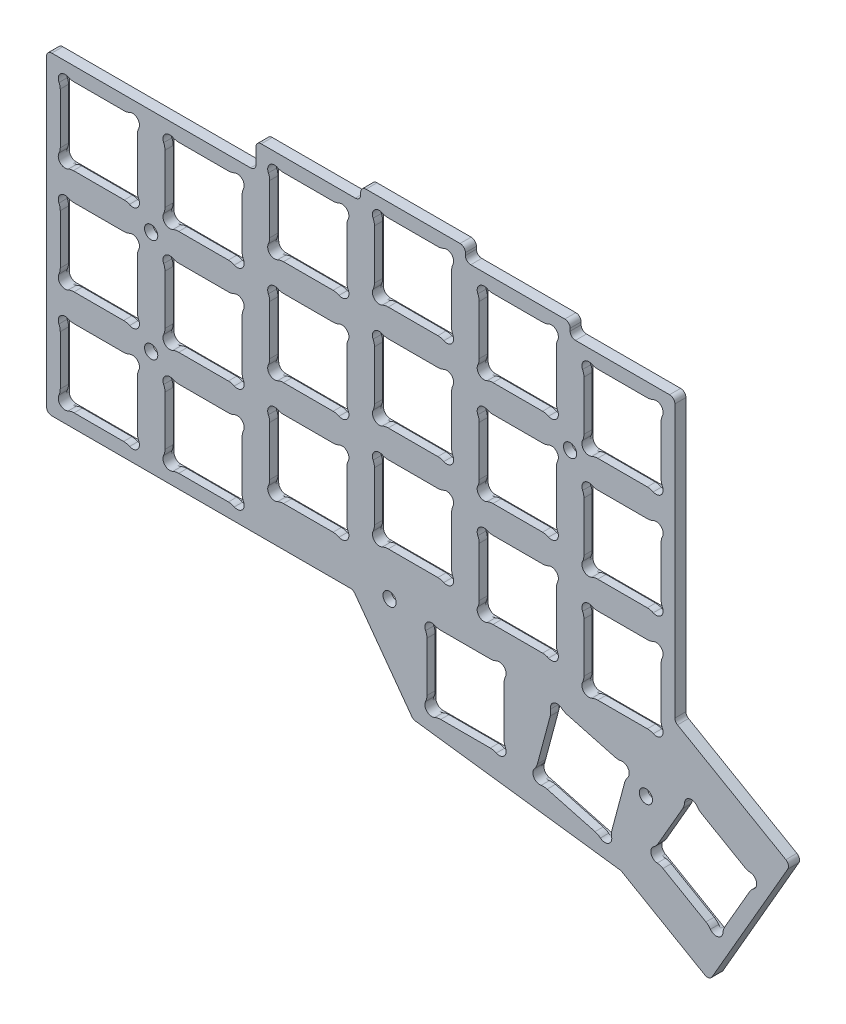
from build123d import *

# Parameters (mm, degrees)
SKETCH2_R           = 1.2
BOSS_EXTRUDE1_DEPTH = 2
FILLET1_R           = 2.5
SKETCH3_R           = 2
CUT_EXTRUDE1_DEPTH  = 0.5


with BuildPart() as part:
    # Sketch2 → Boss-Extrude1 (new body)
    with BuildSketch(Plane.XY):
        with BuildLine():
            ThreePointArc((3.358715952, 91.42556159), (2.678391323, 91.143761902), (2.396591635, 90.463437274))
            Line((2.396591635, 90.463437274), (2.396591635, 35.387693174))
            ThreePointArc((2.396591635, 35.387693174), (2.678391323, 34.707368546), (3.358715952, 34.425568858))
            Line((3.358715952, 34.425568858), (57.55538108, 34.425568858))
            ThreePointArc((57.55538108, 34.425568858), (57.991412266, 34.32109249), (58.332746845, 34.030353412))
            Line((58.332746845, 34.030353412), (68.6731028, 19.851286658))
            ThreePointArc((68.6731028, 19.851286658), (68.959916761, 19.590522811), (69.326358752, 19.464109602))
            Line((69.326358752, 19.464109602), (106.42211034, 14.638604201))
            ThreePointArc((106.42211034, 14.638604201), (106.606561986, 14.595821202), (106.779062685, 14.517742374))
            Line((106.779062685, 14.517742374), (121.831200494, 5.827386558))
            ThreePointArc((121.831200494, 5.827386558), (122.561278749, 5.731269932), (123.145486752, 6.1795485))
            Line((123.145486752, 6.1795485), (136.883362434, 29.974247168))
            ThreePointArc((136.883362434, 29.974247168), (136.979479059, 30.704325424), (136.531200492, 31.288533426))
            Line((136.531200492, 31.288533426), (116.881014221, 42.63357376))
            ThreePointArc((116.881014221, 42.63357376), (116.52885228, 42.985735701), (116.399952063, 43.466797859))
            Line((116.399952063, 43.466797859), (116.399952063, 92.828345033))
            ThreePointArc((116.399952063, 92.828345033), (116.118152375, 93.508669661), (115.437827746, 93.790469349))
            Line((115.437827746, 93.790469349), (98.360317754, 93.790469349))
            ThreePointArc((98.360317754, 93.790469349), (97.679993126, 94.072269037), (97.398193438, 94.752593666))
            Line((97.398193438, 94.752593666), (97.398193438, 95.213192117))
            ThreePointArc((97.398193438, 95.213192117), (97.11639375, 95.893516746), (96.436069121, 96.175316434))
            Line((96.436069121, 96.175316434), (79.359092742, 96.175316434))
            ThreePointArc((79.359092742, 96.175316434), (78.678768113, 96.457116122), (78.396968425, 97.137440751))
            Line((78.396968425, 97.137440751), (78.396968425, 97.587767164))
            ThreePointArc((78.396968425, 97.587767164), (78.115168737, 98.268091793), (77.434844109, 98.54989148))
            Line((77.434844109, 98.54989148), (60.359092745, 98.54989148))
            ThreePointArc((60.359092745, 98.54989148), (59.678768117, 98.268091793), (59.396968429, 97.587767164))
            Line((59.396968429, 97.587767164), (59.396968429, 97.133171852))
            ThreePointArc((59.396968429, 97.133171852), (59.115168741, 96.452847223), (58.434844112, 96.171047535))
            Line((58.434844112, 96.171047535), (41.357156249, 96.171047535))
            ThreePointArc((41.357156249, 96.171047535), (40.676831621, 95.889247847), (40.395031933, 95.208923218))
            Line((40.395031933, 95.208923218), (40.395031933, 92.387685907))
            ThreePointArc((40.395031933, 92.387685907), (40.113232245, 91.707361278), (39.432907616, 91.42556159))
            Line((39.432907616, 91.42556159), (3.358715952, 91.42556159))
        make_face()
        with BuildLine():
            ThreePointArc((17.128824679, 50.925568854), (18.012708155, 51.291685378), (18.896591632, 50.925568854))
            ThreePointArc((18.896591632, 50.925568854), (19.167557571, 50.520039668), (19.262708155, 50.041685378))
            ThreePointArc((19.262708155, 50.041685378), (19.167557571, 49.563331087), (18.896591632, 49.157801901))
            Line((18.896591632, 49.157801901), (18.896591632, 38.693335811))
            ThreePointArc((18.896591632, 38.693335811), (19.167557571, 38.287806624), (19.262708155, 37.809452334))
            ThreePointArc((19.262708155, 37.809452334), (19.167557571, 37.331098044), (18.896591632, 36.925568858))
            ThreePointArc((18.896591632, 36.925568858), (18.012708155, 36.559452334), (17.128824679, 36.925568858))
            Line((17.128824679, 36.925568858), (6.664358588, 36.925568858))
            ThreePointArc((6.664358588, 36.925568858), (5.780475112, 36.559452334), (4.896591635, 36.925568858))
            ThreePointArc((4.896591635, 36.925568858), (4.530475112, 37.809452334), (4.896591635, 38.693335811))
            Line((4.896591635, 38.693335811), (4.896591635, 49.157801901))
            ThreePointArc((4.896591635, 49.157801901), (4.530475112, 50.041685378), (4.896591635, 50.925568854))
            ThreePointArc((4.896591635, 50.925568854), (5.780475112, 51.291685378), (6.664358588, 50.925568854))
            Line((6.664358588, 50.925568854), (17.128824679, 50.925568854))
        make_face(mode=Mode.SUBTRACT)
        with BuildLine():
            ThreePointArc((25.662529929, 36.92624031), (24.778646452, 36.560123786), (23.894762976, 36.92624031))
            ThreePointArc((23.894762976, 36.92624031), (23.528646452, 37.810123786), (23.894762976, 38.694007263))
            Line((23.894762976, 38.694007263), (23.894762976, 49.158473353))
            ThreePointArc((23.894762976, 49.158473353), (23.528646452, 50.04235683), (23.894762976, 50.926240306))
            ThreePointArc((23.894762976, 50.926240306), (24.778646452, 51.29235683), (25.662529929, 50.926240306))
            Line((25.662529929, 50.926240306), (36.126996019, 50.926240306))
            ThreePointArc((36.126996019, 50.926240306), (37.010879496, 51.29235683), (37.894762972, 50.926240306))
            ThreePointArc((37.894762972, 50.926240306), (38.165728911, 50.52071112), (38.260879496, 50.04235683))
            ThreePointArc((38.260879496, 50.04235683), (38.165728911, 49.564002539), (37.894762972, 49.158473353))
            Line((37.894762972, 49.158473353), (37.894762972, 38.694007263))
            ThreePointArc((37.894762972, 38.694007263), (38.165728911, 38.288478077), (38.260879496, 37.810123786))
            ThreePointArc((38.260879496, 37.810123786), (38.165728911, 37.331769496), (37.894762972, 36.92624031))
            ThreePointArc((37.894762972, 36.92624031), (37.010879496, 36.560123786), (36.126996019, 36.92624031))
            Line((36.126996019, 36.92624031), (25.662529929, 36.92624031))
        make_face(mode=Mode.SUBTRACT)
        with Locations((64.637863533, 36.300090173)):
            Circle(SKETCH2_R, mode=Mode.SUBTRACT)
        with BuildLine():
            ThreePointArc((44.662798886, 41.671054802), (43.778915409, 41.304938279), (42.895031933, 41.671054802))
            ThreePointArc((42.895031933, 41.671054802), (42.528915409, 42.554938279), (42.895031933, 43.438821755))
            Line((42.895031933, 43.438821755), (42.895031933, 53.903287846))
            ThreePointArc((42.895031933, 53.903287846), (42.528915409, 54.787171322), (42.895031933, 55.671054799))
            ThreePointArc((42.895031933, 55.671054799), (43.778915409, 56.037171322), (44.662798886, 55.671054799))
            Line((44.662798886, 55.671054799), (55.127264976, 55.671054799))
            ThreePointArc((55.127264976, 55.671054799), (56.011148453, 56.037171322), (56.895031929, 55.671054799))
            ThreePointArc((56.895031929, 55.671054799), (57.165997868, 55.265525613), (57.261148453, 54.787171322))
            ThreePointArc((57.261148453, 54.787171322), (57.165997868, 54.308817032), (56.895031929, 53.903287846))
            Line((56.895031929, 53.903287846), (56.895031929, 43.438821755))
            ThreePointArc((56.895031929, 43.438821755), (57.165997868, 43.033292569), (57.261148453, 42.554938279))
            ThreePointArc((57.261148453, 42.554938279), (57.165997868, 42.076583988), (56.895031929, 41.671054802))
            ThreePointArc((56.895031929, 41.671054802), (56.011148453, 41.304938279), (55.127264976, 41.671054802))
            Line((55.127264976, 41.671054802), (44.662798886, 41.671054802))
        make_face(mode=Mode.SUBTRACT)
        with BuildLine():
            ThreePointArc((63.664735382, 44.049898748), (62.780851905, 43.683782224), (61.896968429, 44.049898748))
            ThreePointArc((61.896968429, 44.049898748), (61.530851905, 44.933782224), (61.896968429, 45.817665701))
            Line((61.896968429, 45.817665701), (61.896968429, 56.282131791))
            ThreePointArc((61.896968429, 56.282131791), (61.530851905, 57.166015268), (61.896968429, 58.049898744))
            ThreePointArc((61.896968429, 58.049898744), (62.780851905, 58.416015268), (63.664735382, 58.049898744))
            Line((63.664735382, 58.049898744), (74.129201472, 58.049898744))
            ThreePointArc((74.129201472, 58.049898744), (75.013084949, 58.416015268), (75.896968425, 58.049898744))
            ThreePointArc((75.896968425, 58.049898744), (76.167934364, 57.644369558), (76.263084949, 57.166015268))
            ThreePointArc((76.263084949, 57.166015268), (76.167934364, 56.687660977), (75.896968425, 56.282131791))
            Line((75.896968425, 56.282131791), (75.896968425, 45.817665701))
            ThreePointArc((75.896968425, 45.817665701), (76.167934364, 45.412136515), (76.263084949, 44.933782224))
            ThreePointArc((76.263084949, 44.933782224), (76.167934364, 44.455427934), (75.896968425, 44.049898748))
            ThreePointArc((75.896968425, 44.049898748), (75.013084949, 43.683782224), (74.129201472, 44.049898748))
            Line((74.129201472, 44.049898748), (63.664735382, 44.049898748))
        make_face(mode=Mode.SUBTRACT)
        with BuildLine():
            ThreePointArc((106.244867582, 31.71451574), (107.193391389, 31.839391268), (107.952399337, 31.256983985))
            ThreePointArc((107.952399337, 31.256983985), (108.077274865, 30.955507792), (108.119867582, 30.631983985))
            ThreePointArc((108.119867582, 30.631983985), (107.952399337, 30.006983985), (107.494867582, 29.549452231))
            Line((107.494867582, 29.549452231), (104.786464461, 19.441554176))
            ThreePointArc((104.786464461, 19.441554176), (104.911339989, 19.140077982), (104.953932707, 18.816554176))
            ThreePointArc((104.953932707, 18.816554176), (104.786464461, 18.191554176), (104.328932707, 17.734022421))
            ThreePointArc((104.328932707, 17.734022421), (103.3804089, 17.609146893), (102.621400952, 18.191554176))
            Line((102.621400952, 18.191554176), (92.513502897, 20.899957297))
            ThreePointArc((92.513502897, 20.899957297), (91.56497909, 20.775081768), (90.805971142, 21.357489051))
            ThreePointArc((90.805971142, 21.357489051), (90.681095614, 22.306012858), (91.263502897, 23.065020806))
            Line((91.263502897, 23.065020806), (93.971906018, 33.172918861))
            ThreePointArc((93.971906018, 33.172918861), (93.84703049, 34.121442668), (94.429437772, 34.880450616))
            ThreePointArc((94.429437772, 34.880450616), (95.377961579, 35.005326144), (96.136969527, 34.422918861))
            Line((96.136969527, 34.422918861), (106.244867582, 31.71451574))
        make_face(mode=Mode.SUBTRACT)
        with Locations((111.137845658, 28.550051811)):
            Circle(SKETCH2_R, mode=Mode.SUBTRACT)
        with BuildLine():
            ThreePointArc((113.605936524, 19.12102891), (112.657412717, 19.245904438), (112.075005434, 20.004912386))
            ThreePointArc((112.075005434, 20.004912386), (112.199880962, 20.953436193), (112.958888911, 21.535843475))
            Line((112.958888911, 21.535843475), (118.191121956, 30.598336947))
            ThreePointArc((118.191121956, 30.598336947), (118.315997484, 31.546860753), (119.075005433, 32.129268036))
            ThreePointArc((119.075005433, 32.129268036), (120.023529239, 32.004392508), (120.605936522, 31.24538456))
            Line((120.605936522, 31.24538456), (129.668429993, 26.013151514))
            ThreePointArc((129.668429993, 26.013151514), (130.6169538, 25.888275986), (131.199361083, 25.129268038))
            ThreePointArc((131.199361083, 25.129268038), (131.231259876, 24.968901972), (131.2419538, 24.805744231))
            ThreePointArc((131.2419538, 24.805744231), (130.983645475, 24.044792445), (130.315477606, 23.598336949))
            Line((130.315477606, 23.598336949), (125.083244561, 14.535843477))
            ThreePointArc((125.083244561, 14.535843477), (125.115143355, 14.375477411), (125.125837278, 14.212319671))
            ThreePointArc((125.125837278, 14.212319671), (124.867528953, 13.451367885), (124.199361084, 13.004912388))
            ThreePointArc((124.199361084, 13.004912388), (123.250837278, 13.129787916), (122.668429995, 13.888795864))
            Line((122.668429995, 13.888795864), (113.605936524, 19.12102891))
        make_face(mode=Mode.SUBTRACT)
        with BuildLine():
            ThreePointArc((83.648818986, 36.01741384), (84.532702463, 36.383530364), (85.416585939, 36.01741384))
            ThreePointArc((85.416585939, 36.01741384), (85.687551879, 35.611884654), (85.782702463, 35.133530364))
            ThreePointArc((85.782702463, 35.133530364), (85.687551879, 34.655176073), (85.416585939, 34.249646887))
            Line((85.416585939, 34.249646887), (85.416585939, 23.785180797))
            ThreePointArc((85.416585939, 23.785180797), (85.687551879, 23.379651611), (85.782702463, 22.90129732))
            ThreePointArc((85.782702463, 22.90129732), (85.687551879, 22.42294303), (85.416585939, 22.017413844))
            ThreePointArc((85.416585939, 22.017413844), (84.532702463, 21.65129732), (83.648818986, 22.017413844))
            Line((83.648818986, 22.017413844), (73.184352896, 22.017413844))
            ThreePointArc((73.184352896, 22.017413844), (72.300469419, 21.65129732), (71.416585943, 22.017413844))
            ThreePointArc((71.416585943, 22.017413844), (71.050469419, 22.90129732), (71.416585943, 23.785180797))
            Line((71.416585943, 23.785180797), (71.416585943, 34.249646887))
            ThreePointArc((71.416585943, 34.249646887), (71.050469419, 35.133530364), (71.416585943, 36.01741384))
            ThreePointArc((71.416585943, 36.01741384), (72.300469419, 36.383530364), (73.184352896, 36.01741384))
            Line((73.184352896, 36.01741384), (83.648818986, 36.01741384))
        make_face(mode=Mode.SUBTRACT)
        with BuildLine():
            ThreePointArc((82.665960394, 41.675323701), (81.782076918, 41.309207178), (80.898193441, 41.675323701))
            ThreePointArc((80.898193441, 41.675323701), (80.532076918, 42.559207178), (80.898193441, 43.443090654))
            Line((80.898193441, 43.443090654), (80.898193441, 53.907556745))
            ThreePointArc((80.898193441, 53.907556745), (80.532076918, 54.791440221), (80.898193441, 55.675323698))
            ThreePointArc((80.898193441, 55.675323698), (81.782076918, 56.041440221), (82.665960394, 55.675323698))
            Line((82.665960394, 55.675323698), (93.130426485, 55.675323698))
            ThreePointArc((93.130426485, 55.675323698), (94.014309961, 56.041440221), (94.898193438, 55.675323698))
            ThreePointArc((94.898193438, 55.675323698), (95.169159377, 55.269794512), (95.264309961, 54.791440221))
            ThreePointArc((95.264309961, 54.791440221), (95.169159377, 54.313085931), (94.898193438, 53.907556745))
            Line((94.898193438, 53.907556745), (94.898193438, 43.443090654))
            ThreePointArc((94.898193438, 43.443090654), (95.169159377, 43.037561468), (95.264309961, 42.559207178))
            ThreePointArc((95.264309961, 42.559207178), (95.169159377, 42.080852887), (94.898193438, 41.675323701))
            ThreePointArc((94.898193438, 41.675323701), (94.014309961, 41.309207178), (93.130426485, 41.675323701))
            Line((93.130426485, 41.675323701), (82.665960394, 41.675323701))
        make_face(mode=Mode.SUBTRACT)
        with BuildLine():
            ThreePointArc((101.667719019, 39.290476616), (100.783835543, 38.924360093), (99.899952066, 39.290476616))
            ThreePointArc((99.899952066, 39.290476616), (99.533835543, 40.174360093), (99.899952066, 41.058243569))
            Line((99.899952066, 41.058243569), (99.899952066, 51.52270966))
            ThreePointArc((99.899952066, 51.52270966), (99.533835543, 52.406593136), (99.899952066, 53.290476613))
            ThreePointArc((99.899952066, 53.290476613), (100.783835543, 53.656593136), (101.667719019, 53.290476613))
            Line((101.667719019, 53.290476613), (112.13218511, 53.290476613))
            ThreePointArc((112.13218511, 53.290476613), (113.016068586, 53.656593136), (113.899952063, 53.290476613))
            ThreePointArc((113.899952063, 53.290476613), (114.170918002, 52.884947427), (114.266068586, 52.406593136))
            ThreePointArc((114.266068586, 52.406593136), (114.170918002, 51.928238846), (113.899952063, 51.52270966))
            Line((113.899952063, 51.52270966), (113.899952063, 41.058243569))
            ThreePointArc((113.899952063, 41.058243569), (114.170918002, 40.652714383), (114.266068586, 40.174360093))
            ThreePointArc((114.266068586, 40.174360093), (114.170918002, 39.696005802), (113.899952063, 39.290476616))
            ThreePointArc((113.899952063, 39.290476616), (113.016068586, 38.924360093), (112.13218511, 39.290476616))
            Line((112.13218511, 39.290476616), (101.667719019, 39.290476616))
        make_face(mode=Mode.SUBTRACT)
        with BuildLine():
            ThreePointArc((6.664358588, 55.925568853), (5.780475112, 55.559452329), (4.896591635, 55.925568853))
            ThreePointArc((4.896591635, 55.925568853), (4.530475112, 56.809452329), (4.896591635, 57.693335806))
            Line((4.896591635, 57.693335806), (4.896591635, 68.157801896))
            ThreePointArc((4.896591635, 68.157801896), (4.530475112, 69.041685373), (4.896591635, 69.925568849))
            ThreePointArc((4.896591635, 69.925568849), (5.780475112, 70.291685373), (6.664358588, 69.925568849))
            Line((6.664358588, 69.925568849), (17.128824679, 69.925568849))
            ThreePointArc((17.128824679, 69.925568849), (18.012708155, 70.291685373), (18.896591632, 69.925568849))
            ThreePointArc((18.896591632, 69.925568849), (19.167557571, 69.520039663), (19.262708155, 69.041685373))
            ThreePointArc((19.262708155, 69.041685373), (19.167557571, 68.563331082), (18.896591632, 68.157801896))
            Line((18.896591632, 68.157801896), (18.896591632, 57.693335806))
            ThreePointArc((18.896591632, 57.693335806), (19.167557571, 57.28780662), (19.262708155, 56.809452329))
            ThreePointArc((19.262708155, 56.809452329), (19.167557571, 56.331098039), (18.896591632, 55.925568853))
            ThreePointArc((18.896591632, 55.925568853), (18.012708155, 55.559452329), (17.128824679, 55.925568853))
            Line((17.128824679, 55.925568853), (6.664358588, 55.925568853))
        make_face(mode=Mode.SUBTRACT)
        with Locations((21.387798276, 53.550235091)):
            Circle(SKETCH2_R, mode=Mode.SUBTRACT)
        with BuildLine():
            ThreePointArc((25.662529929, 55.926240305), (24.778646452, 55.560123781), (23.894762976, 55.926240305))
            ThreePointArc((23.894762976, 55.926240305), (23.528646452, 56.810123781), (23.894762976, 57.694007258))
            Line((23.894762976, 57.694007258), (23.894762976, 68.158473348))
            ThreePointArc((23.894762976, 68.158473348), (23.528646452, 69.042356825), (23.894762976, 69.926240301))
            ThreePointArc((23.894762976, 69.926240301), (24.778646452, 70.292356825), (25.662529929, 69.926240301))
            Line((25.662529929, 69.926240301), (36.126996019, 69.926240301))
            ThreePointArc((36.126996019, 69.926240301), (37.010879496, 70.292356825), (37.894762972, 69.926240301))
            ThreePointArc((37.894762972, 69.926240301), (38.165728911, 69.520711115), (38.260879496, 69.042356825))
            ThreePointArc((38.260879496, 69.042356825), (38.165728911, 68.564002534), (37.894762972, 68.158473348))
            Line((37.894762972, 68.158473348), (37.894762972, 57.694007258))
            ThreePointArc((37.894762972, 57.694007258), (38.165728911, 57.288478072), (38.260879496, 56.810123781))
            ThreePointArc((38.260879496, 56.810123781), (38.165728911, 56.331769491), (37.894762972, 55.926240305))
            ThreePointArc((37.894762972, 55.926240305), (37.010879496, 55.560123781), (36.126996019, 55.926240305))
            Line((36.126996019, 55.926240305), (25.662529929, 55.926240305))
        make_face(mode=Mode.SUBTRACT)
        with Locations((21.387798276, 72.300241098)):
            Circle(SKETCH2_R, mode=Mode.SUBTRACT)
        with BuildLine():
            ThreePointArc((44.662798886, 60.671054797), (43.778915409, 60.304938274), (42.895031933, 60.671054797))
            ThreePointArc((42.895031933, 60.671054797), (42.528915409, 61.554938274), (42.895031933, 62.43882175))
            Line((42.895031933, 62.43882175), (42.895031933, 72.903287841))
            ThreePointArc((42.895031933, 72.903287841), (42.528915409, 73.787171317), (42.895031933, 74.671054794))
            ThreePointArc((42.895031933, 74.671054794), (43.778915409, 75.037171317), (44.662798886, 74.671054794))
            Line((44.662798886, 74.671054794), (55.127264976, 74.671054794))
            ThreePointArc((55.127264976, 74.671054794), (56.011148453, 75.037171317), (56.895031929, 74.671054794))
            ThreePointArc((56.895031929, 74.671054794), (57.165997868, 74.265525608), (57.261148453, 73.787171317))
            ThreePointArc((57.261148453, 73.787171317), (57.165997868, 73.308817027), (56.895031929, 72.903287841))
            Line((56.895031929, 72.903287841), (56.895031929, 62.43882175))
            ThreePointArc((56.895031929, 62.43882175), (57.165997868, 62.033292564), (57.261148453, 61.554938274))
            ThreePointArc((57.261148453, 61.554938274), (57.165997868, 61.076583983), (56.895031929, 60.671054797))
            ThreePointArc((56.895031929, 60.671054797), (56.011148453, 60.304938274), (55.127264976, 60.671054797))
            Line((55.127264976, 60.671054797), (44.662798886, 60.671054797))
        make_face(mode=Mode.SUBTRACT)
        with BuildLine():
            ThreePointArc((63.664735382, 63.049898743), (62.780851905, 62.683782219), (61.896968429, 63.049898743))
            ThreePointArc((61.896968429, 63.049898743), (61.530851905, 63.933782219), (61.896968429, 64.817665696))
            Line((61.896968429, 64.817665696), (61.896968429, 75.282131786))
            ThreePointArc((61.896968429, 75.282131786), (61.530851905, 76.166015263), (61.896968429, 77.049898739))
            ThreePointArc((61.896968429, 77.049898739), (62.780851905, 77.416015263), (63.664735382, 77.049898739))
            Line((63.664735382, 77.049898739), (74.129201472, 77.049898739))
            ThreePointArc((74.129201472, 77.049898739), (75.013084949, 77.416015263), (75.896968425, 77.049898739))
            ThreePointArc((75.896968425, 77.049898739), (76.167934364, 76.644369553), (76.263084949, 76.166015263))
            ThreePointArc((76.263084949, 76.166015263), (76.167934364, 75.687660972), (75.896968425, 75.282131786))
            Line((75.896968425, 75.282131786), (75.896968425, 64.817665696))
            ThreePointArc((75.896968425, 64.817665696), (76.167934364, 64.41213651), (76.263084949, 63.933782219))
            ThreePointArc((76.263084949, 63.933782219), (76.167934364, 63.455427929), (75.896968425, 63.049898743))
            ThreePointArc((75.896968425, 63.049898743), (75.013084949, 62.683782219), (74.129201472, 63.049898743))
            Line((74.129201472, 63.049898743), (63.664735382, 63.049898743))
        make_face(mode=Mode.SUBTRACT)
        with BuildLine():
            ThreePointArc((17.436334559, 74.700259118), (16.988797184, 74.868419675), (16.514136804, 74.925561594))
            Line((16.514136804, 74.925561594), (7.279046463, 74.925561594))
            ThreePointArc((7.279046463, 74.925561594), (6.804386083, 74.868419675), (6.356848708, 74.700259118))
            ThreePointArc((6.356848708, 74.700259118), (4.896591635, 74.925561594), (4.671289159, 76.385818667))
            ThreePointArc((4.671289159, 76.385818667), (4.839449716, 76.833356042), (4.896591635, 77.308016421))
            Line((4.896591635, 77.308016421), (4.896591635, 86.543106763))
            ThreePointArc((4.896591635, 86.543106763), (4.839449716, 87.017767143), (4.671289159, 87.465304517))
            ThreePointArc((4.671289159, 87.465304517), (4.896591635, 88.92556159), (6.356848708, 89.150864066))
            ThreePointArc((6.356848708, 89.150864066), (6.804386083, 88.982703509), (7.279046463, 88.92556159))
            Line((7.279046463, 88.92556159), (16.514136804, 88.92556159))
            ThreePointArc((16.514136804, 88.92556159), (16.988797184, 88.982703509), (17.436334559, 89.150864066))
            ThreePointArc((17.436334559, 89.150864066), (18.896591632, 88.92556159), (19.121894108, 87.465304517))
            ThreePointArc((19.121894108, 87.465304517), (18.95373355, 87.017767143), (18.896591632, 86.543106763))
            Line((18.896591632, 86.543106763), (18.896591632, 77.308016421))
            ThreePointArc((18.896591632, 77.308016421), (18.95373355, 76.833356042), (19.121894108, 76.385818667))
            ThreePointArc((19.121894108, 76.385818667), (18.896591632, 74.925561594), (17.436334559, 74.700259118))
        make_face(mode=Mode.SUBTRACT)
        with BuildLine():
            ThreePointArc((23.894762976, 87.15846609), (23.528646452, 88.042349566), (23.894762976, 88.926233042))
            ThreePointArc((23.894762976, 88.926233042), (24.778646452, 89.292349566), (25.662529929, 88.926233042))
            Line((25.662529929, 88.926233042), (36.126996019, 88.926233042))
            ThreePointArc((36.126996019, 88.926233042), (37.010879496, 89.292349566), (37.894762972, 88.926233042))
            ThreePointArc((37.894762972, 88.926233042), (38.165728911, 88.520703856), (38.260879496, 88.042349566))
            ThreePointArc((38.260879496, 88.042349566), (38.165728911, 87.563995276), (37.894762972, 87.15846609))
            Line((37.894762972, 87.15846609), (37.894762972, 76.693999999))
            ThreePointArc((37.894762972, 76.693999999), (38.165728911, 76.288470813), (38.260879496, 75.810116522))
            ThreePointArc((38.260879496, 75.810116522), (38.165728911, 75.331762232), (37.894762972, 74.926233046))
            ThreePointArc((37.894762972, 74.926233046), (37.010879496, 74.560116522), (36.126996019, 74.926233046))
            Line((36.126996019, 74.926233046), (25.662529929, 74.926233046))
            ThreePointArc((25.662529929, 74.926233046), (24.778646452, 74.560116522), (23.894762976, 74.926233046))
            ThreePointArc((23.894762976, 74.926233046), (23.528646452, 75.810116522), (23.894762976, 76.693999999))
            Line((23.894762976, 76.693999999), (23.894762976, 87.15846609))
        make_face(mode=Mode.SUBTRACT)
        with BuildLine():
            ThreePointArc((44.662798886, 79.671047539), (43.778915409, 79.304931015), (42.895031933, 79.671047539))
            ThreePointArc((42.895031933, 79.671047539), (42.528915409, 80.554931015), (42.895031933, 81.438814491))
            Line((42.895031933, 81.438814491), (42.895031933, 91.903280582))
            ThreePointArc((42.895031933, 91.903280582), (42.528915409, 92.787164059), (42.895031933, 93.671047535))
            ThreePointArc((42.895031933, 93.671047535), (43.778915409, 94.037164059), (44.662798886, 93.671047535))
            Line((44.662798886, 93.671047535), (55.127264976, 93.671047535))
            ThreePointArc((55.127264976, 93.671047535), (56.011148453, 94.037164059), (56.895031929, 93.671047535))
            ThreePointArc((56.895031929, 93.671047535), (57.165997868, 93.265518349), (57.261148453, 92.787164059))
            ThreePointArc((57.261148453, 92.787164059), (57.165997868, 92.308809768), (56.895031929, 91.903280582))
            Line((56.895031929, 91.903280582), (56.895031929, 81.438814491))
            ThreePointArc((56.895031929, 81.438814491), (57.165997868, 81.033285305), (57.261148453, 80.554931015))
            ThreePointArc((57.261148453, 80.554931015), (57.165997868, 80.076576725), (56.895031929, 79.671047539))
            ThreePointArc((56.895031929, 79.671047539), (56.011148453, 79.304931015), (55.127264976, 79.671047539))
            Line((55.127264976, 79.671047539), (44.662798886, 79.671047539))
        make_face(mode=Mode.SUBTRACT)
        with BuildLine():
            ThreePointArc((63.664735382, 82.049891484), (62.780851905, 81.68377496), (61.896968429, 82.049891484))
            ThreePointArc((61.896968429, 82.049891484), (61.530851905, 82.93377496), (61.896968429, 83.817658437))
            Line((61.896968429, 83.817658437), (61.896968429, 94.282124528))
            ThreePointArc((61.896968429, 94.282124528), (61.530851905, 95.166008004), (61.896968429, 96.04989148))
            ThreePointArc((61.896968429, 96.04989148), (62.780851905, 96.416008004), (63.664735382, 96.04989148))
            Line((63.664735382, 96.04989148), (74.129201472, 96.04989148))
            ThreePointArc((74.129201472, 96.04989148), (75.013084949, 96.416008004), (75.896968425, 96.04989148))
            ThreePointArc((75.896968425, 96.04989148), (76.167934364, 95.644362294), (76.263084949, 95.166008004))
            ThreePointArc((76.263084949, 95.166008004), (76.167934364, 94.687653714), (75.896968425, 94.282124528))
            Line((75.896968425, 94.282124528), (75.896968425, 83.817658437))
            ThreePointArc((75.896968425, 83.817658437), (76.167934364, 83.412129251), (76.263084949, 82.93377496))
            ThreePointArc((76.263084949, 82.93377496), (76.167934364, 82.45542067), (75.896968425, 82.049891484))
            ThreePointArc((75.896968425, 82.049891484), (75.013084949, 81.68377496), (74.129201472, 82.049891484))
            Line((74.129201472, 82.049891484), (63.664735382, 82.049891484))
        make_face(mode=Mode.SUBTRACT)
        with BuildLine():
            ThreePointArc((93.130426485, 74.675323693), (94.014309961, 75.041440216), (94.898193438, 74.675323693))
            ThreePointArc((94.898193438, 74.675323693), (95.169159377, 74.269794507), (95.264309961, 73.791440216))
            ThreePointArc((95.264309961, 73.791440216), (95.169159377, 73.313085926), (94.898193438, 72.90755674))
            Line((94.898193438, 72.90755674), (94.898193438, 62.443090649))
            ThreePointArc((94.898193438, 62.443090649), (95.169159377, 62.037561463), (95.264309961, 61.559207173))
            ThreePointArc((95.264309961, 61.559207173), (95.169159377, 61.080852882), (94.898193438, 60.675323696))
            ThreePointArc((94.898193438, 60.675323696), (94.014309961, 60.309207173), (93.130426485, 60.675323696))
            Line((93.130426485, 60.675323696), (82.665960394, 60.675323696))
            ThreePointArc((82.665960394, 60.675323696), (81.782076918, 60.309207173), (80.898193441, 60.675323696))
            ThreePointArc((80.898193441, 60.675323696), (80.532076918, 61.559207173), (80.898193441, 62.443090649))
            Line((80.898193441, 62.443090649), (80.898193441, 72.90755674))
            ThreePointArc((80.898193441, 72.90755674), (80.532076918, 73.791440216), (80.898193441, 74.675323693))
            ThreePointArc((80.898193441, 74.675323693), (81.782076918, 75.041440216), (82.665960394, 74.675323693))
            Line((82.665960394, 74.675323693), (93.130426485, 74.675323693))
        make_face(mode=Mode.SUBTRACT)
        with BuildLine():
            ThreePointArc((101.667719019, 58.290476612), (100.783835543, 57.924360088), (99.899952066, 58.290476612))
            ThreePointArc((99.899952066, 58.290476612), (99.533835543, 59.174360088), (99.899952066, 60.058243565))
            Line((99.899952066, 60.058243565), (99.899952066, 70.522709655))
            ThreePointArc((99.899952066, 70.522709655), (99.533835543, 71.406593132), (99.899952066, 72.290476608))
            ThreePointArc((99.899952066, 72.290476608), (100.783835543, 72.656593132), (101.667719019, 72.290476608))
            Line((101.667719019, 72.290476608), (112.13218511, 72.290476608))
            ThreePointArc((112.13218511, 72.290476608), (113.016068586, 72.656593132), (113.899952063, 72.290476608))
            ThreePointArc((113.899952063, 72.290476608), (114.170918002, 71.884947422), (114.266068586, 71.406593132))
            ThreePointArc((114.266068586, 71.406593132), (114.170918002, 70.928238841), (113.899952063, 70.522709655))
            Line((113.899952063, 70.522709655), (113.899952063, 60.058243565))
            ThreePointArc((113.899952063, 60.058243565), (114.170918002, 59.652714379), (114.266068586, 59.174360088))
            ThreePointArc((114.266068586, 59.174360088), (114.170918002, 58.696005798), (113.899952063, 58.290476612))
            ThreePointArc((113.899952063, 58.290476612), (113.016068586, 57.924360088), (112.13218511, 58.290476612))
            Line((112.13218511, 58.290476612), (101.667719019, 58.290476612))
        make_face(mode=Mode.SUBTRACT)
        with Locations((97.387827206, 76.050038887)):
            Circle(SKETCH2_R, mode=Mode.SUBTRACT)
        with BuildLine():
            ThreePointArc((82.665960394, 79.675316437), (81.782076918, 79.309199914), (80.898193441, 79.675316437))
            ThreePointArc((80.898193441, 79.675316437), (80.532076918, 80.559199914), (80.898193441, 81.44308339))
            Line((80.898193441, 81.44308339), (80.898193441, 91.907549481))
            ThreePointArc((80.898193441, 91.907549481), (80.532076918, 92.791432957), (80.898193441, 93.675316434))
            ThreePointArc((80.898193441, 93.675316434), (81.782076918, 94.041432957), (82.665960394, 93.675316434))
            Line((82.665960394, 93.675316434), (93.130426485, 93.675316434))
            ThreePointArc((93.130426485, 93.675316434), (94.014309961, 94.041432957), (94.898193438, 93.675316434))
            ThreePointArc((94.898193438, 93.675316434), (95.169159377, 93.269787248), (95.264309961, 92.791432957))
            ThreePointArc((95.264309961, 92.791432957), (95.169159377, 92.313078667), (94.898193438, 91.907549481))
            Line((94.898193438, 91.907549481), (94.898193438, 81.44308339))
            ThreePointArc((94.898193438, 81.44308339), (95.169159377, 81.037554204), (95.264309961, 80.559199914))
            ThreePointArc((95.264309961, 80.559199914), (95.169159377, 80.080845624), (94.898193438, 79.675316437))
            ThreePointArc((94.898193438, 79.675316437), (94.014309961, 79.309199914), (93.130426485, 79.675316437))
            Line((93.130426485, 79.675316437), (82.665960394, 79.675316437))
        make_face(mode=Mode.SUBTRACT)
        with BuildLine():
            ThreePointArc((101.667719019, 77.290469353), (100.783835543, 76.924352829), (99.899952066, 77.290469353))
            ThreePointArc((99.899952066, 77.290469353), (99.533835543, 78.174352829), (99.899952066, 79.058236306))
            Line((99.899952066, 79.058236306), (99.899952066, 89.522702396))
            ThreePointArc((99.899952066, 89.522702396), (99.533835543, 90.406585873), (99.899952066, 91.290469349))
            ThreePointArc((99.899952066, 91.290469349), (100.783835543, 91.656585873), (101.667719019, 91.290469349))
            Line((101.667719019, 91.290469349), (112.13218511, 91.290469349))
            ThreePointArc((112.13218511, 91.290469349), (113.016068586, 91.656585873), (113.899952063, 91.290469349))
            ThreePointArc((113.899952063, 91.290469349), (114.170918002, 90.884940163), (114.266068586, 90.406585873))
            ThreePointArc((114.266068586, 90.406585873), (114.170918002, 89.928231582), (113.899952063, 89.522702396))
            Line((113.899952063, 89.522702396), (113.899952063, 79.058236306))
            ThreePointArc((113.899952063, 79.058236306), (114.170918002, 78.65270712), (114.266068586, 78.174352829))
            ThreePointArc((114.266068586, 78.174352829), (114.170918002, 77.695998539), (113.899952063, 77.290469353))
            ThreePointArc((113.899952063, 77.290469353), (113.016068586, 76.924352829), (112.13218511, 77.290469353))
            Line((112.13218511, 77.290469353), (101.667719019, 77.290469353))
        make_face(mode=Mode.SUBTRACT)
    extrude(amount=BOSS_EXTRUDE1_DEPTH)

    # Fillet1
    fillet1_edges = [part.edges().sort_by_distance(p)[0] for p in [
        (44.662798886, 79.671047539, 1),
        (42.895031933, 81.438814491, 1),
        (55.127264976, 79.671047539, 1),
        (56.895031929, 81.438814491, 1),
        (56.895031929, 91.903280582, 1),
        (55.127264976, 93.671047535, 1),
        (42.895031933, 91.903280582, 1),
        (44.662798886, 93.671047535, 1),
        (37.894762972, 76.693999999, 1),
        (37.894762972, 87.15846609, 1),
        (36.126996019, 88.926233042, 1),
        (25.662529929, 88.926233042, 1),
        (36.126996019, 74.926233046, 1),
        (25.662529929, 74.926233046, 1),
        (23.894762976, 76.693999999, 1),
        (23.894762976, 87.15846609, 1),
        (74.129201472, 96.04989148, 1),
        (75.896968425, 94.282124528, 1),
        (75.896968425, 83.817658437, 1),
        (74.129201472, 82.049891484, 1),
        (63.664735382, 96.04989148, 1),
        (63.664735382, 82.049891484, 1),
        (61.896968429, 83.817658437, 1),
        (61.896968429, 94.282124528, 1),
        (55.127264976, 55.671054799, 1),
        (56.895031929, 53.903287846, 1),
        (44.662798886, 55.671054799, 1),
        (42.895031933, 53.903287846, 1),
        (42.895031933, 43.438821755, 1),
        (44.662798886, 41.671054802, 1),
        (56.895031929, 43.438821755, 1),
        (55.127264976, 41.671054802, 1),
        (25.662529929, 50.926240306, 1),
        (23.894762976, 49.158473353, 1),
        (36.126996019, 50.926240306, 1),
        (37.894762972, 49.158473353, 1),
        (37.894762972, 38.694007263, 1),
        (36.126996019, 36.92624031, 1),
        (23.894762976, 38.694007263, 1),
        (25.662529929, 36.92624031, 1),
        (17.128824679, 50.925568854, 1),
        (18.896591632, 49.157801901, 1),
        (6.664358588, 50.925568854, 1),
        (4.896591635, 49.157801901, 1),
        (4.896591635, 38.693335811, 1),
        (6.664358588, 36.925568858, 1),
        (17.128824679, 36.925568858, 1),
        (18.896591632, 38.693335811, 1),
        (6.664358588, 69.925568849, 1),
        (4.896591635, 68.157801896, 1),
        (4.896591635, 57.693335806, 1),
        (6.664358588, 55.925568853, 1),
        (17.128824679, 55.925568853, 1),
        (18.896591632, 57.693335806, 1),
        (17.128824679, 69.925568849, 1),
        (18.896591632, 68.157801896, 1),
        (23.894762976, 68.158473348, 1),
        (25.662529929, 69.926240301, 1),
        (23.894762976, 57.694007258, 1),
        (25.662529929, 55.926240305, 1),
        (36.126996019, 55.926240305, 1),
        (37.894762972, 57.694007258, 1),
        (36.126996019, 69.926240301, 1),
        (37.894762972, 68.158473348, 1),
        (42.895031933, 62.43882175, 1),
        (44.662798886, 60.671054797, 1),
        (55.127264976, 60.671054797, 1),
        (56.895031929, 62.43882175, 1),
        (42.895031933, 72.903287841, 1),
        (44.662798886, 74.671054794, 1),
        (55.127264976, 74.671054794, 1),
        (56.895031929, 72.903287841, 1),
        (74.129201472, 77.049898739, 1),
        (63.664735382, 77.049898739, 1),
        (61.896968429, 75.282131786, 1),
        (61.896968429, 64.817665696, 1),
        (63.664735382, 63.049898743, 1),
        (74.129201472, 63.049898743, 1),
        (75.896968425, 64.817665696, 1),
        (75.896968425, 75.282131786, 1),
        (63.664735382, 58.049898744, 1),
        (61.896968429, 56.282131791, 1),
        (61.896968429, 45.817665701, 1),
        (63.664735382, 44.049898748, 1),
        (74.129201472, 58.049898744, 1),
        (75.896968425, 56.282131791, 1),
        (74.129201472, 44.049898748, 1),
        (75.896968425, 45.817665701, 1),
        (71.416585943, 23.785180797, 1),
        (73.184352896, 22.017413844, 1),
        (71.416585943, 34.249646887, 1),
        (73.184352896, 36.01741384, 1),
        (83.648818986, 36.01741384, 1),
        (85.416585939, 34.249646887, 1),
        (93.130426485, 55.675323698, 1),
        (82.665960394, 55.675323698, 1),
        (80.898193441, 53.907556745, 1),
        (80.898193441, 43.443090654, 1),
        (82.665960394, 41.675323701, 1),
        (93.130426485, 41.675323701, 1),
        (94.898193438, 43.443090654, 1),
        (94.898193438, 53.907556745, 1),
        (82.665960394, 74.675323693, 1),
        (80.898193441, 72.90755674, 1),
        (80.898193441, 62.443090649, 1),
        (82.665960394, 60.675323696, 1),
        (93.130426485, 60.675323696, 1),
        (94.898193438, 62.443090649, 1),
        (93.130426485, 74.675323693, 1),
        (94.898193438, 72.90755674, 1),
        (102.621400952, 18.191554176, 1),
        (83.648818986, 22.017413844, 1),
        (85.416585939, 23.785180797, 1),
        (92.513502897, 20.899957297, 1),
        (91.263502897, 23.065020806, 1),
        (93.971906018, 33.172918861, 1),
        (96.136969527, 34.422918861, 1),
        (107.494867582, 29.549452231, 1),
        (106.244867582, 31.71451574, 1),
        (112.958888911, 21.535843475, 1),
        (113.605936524, 19.12102891, 1),
        (122.668429995, 13.888795864, 1),
        (125.083244561, 14.535843477, 1),
        (130.315477606, 23.598336949, 1),
        (129.668429993, 26.013151514, 1),
        (120.605936522, 31.24538456, 1),
        (118.191121956, 30.598336947, 1),
        (101.667719019, 39.290476616, 1),
        (99.899952066, 41.058243569, 1),
        (112.13218511, 39.290476616, 1),
        (113.899952063, 41.058243569, 1),
        (113.899952063, 51.52270966, 1),
        (112.13218511, 53.290476613, 1),
        (99.899952066, 51.52270966, 1),
        (101.667719019, 53.290476613, 1),
        (99.899952066, 60.058243565, 1),
        (101.667719019, 58.290476612, 1),
        (112.13218511, 58.290476612, 1),
        (113.899952063, 60.058243565, 1),
        (113.899952063, 70.522709655, 1),
        (112.13218511, 72.290476608, 1),
        (101.667719019, 72.290476608, 1),
        (99.899952066, 70.522709655, 1),
        (101.667719019, 77.290469353, 1),
        (99.899952066, 79.058236306, 1),
        (112.13218511, 77.290469353, 1),
        (113.899952063, 79.058236306, 1),
        (113.899952063, 89.522702396, 1),
        (112.13218511, 91.290469349, 1),
        (99.899952066, 89.522702396, 1),
        (101.667719019, 91.290469349, 1),
        (93.130426485, 93.675316434, 1),
        (94.898193438, 91.907549481, 1),
        (94.898193438, 81.44308339, 1),
        (93.130426485, 79.675316437, 1),
        (82.665960394, 79.675316437, 1),
        (80.898193441, 91.907549481, 1),
        (80.898193441, 81.44308339, 1),
        (82.665960394, 93.675316434, 1),
        (104.786464461, 19.441554176, 1),
    ]]
    fillet(fillet1_edges, radius=FILLET1_R)

    # Sketch3 → Cut-Extrude1 (cut)
    with BuildSketch(Plane.XY):
        with Locations((64.637863533, 36.300090173)):
            Circle(SKETCH3_R)
        with Locations((97.387827206, 76.050038887)):
            Circle(SKETCH3_R)
        with Locations((111.137845658, 28.550051811)):
            Circle(SKETCH3_R)
        with Locations((21.387798276, 72.300241098)):
            Circle(SKETCH3_R)
        with Locations((21.387798276, 53.550235091)):
            Circle(SKETCH3_R)
        Polygon((100.783835543, 90.406585873), (99.533835543, 90.406585873), (99.533835543, 78.174352829), (100.783835543, 78.174352829), (100.783835543, 76.924352829), (113.016068586, 76.924352829), (113.016068586, 78.174352829), (114.266068586, 78.174352829), (114.266068586, 90.406585873), (113.016068586, 90.406585873), (113.016068586, 91.656585873), (100.783835543, 91.656585873), align=None)
        Polygon((94.014309961, 92.791432957), (95.264309961, 92.791432957), (95.264309961, 80.559199914), (94.014309961, 80.559199914), (94.014309961, 79.309199914), (81.782076918, 79.309199914), (81.782076918, 80.559199914), (80.532076918, 80.559199914), (80.532076918, 92.791432957), (81.782076918, 92.791432957), (81.782076918, 94.041432957), (94.014309961, 94.041432957), align=None)
        Polygon((75.013084949, 95.166008004), (76.263084949, 95.166008004), (76.263084949, 82.93377496), (75.013084949, 82.93377496), (75.013084949, 81.68377496), (62.780851905, 81.68377496), (62.780851905, 82.93377496), (61.530851905, 82.93377496), (61.530851905, 95.166008004), (62.780851905, 95.166008004), (62.780851905, 96.416008004), (75.013084949, 96.416008004), align=None)
        Polygon((56.011148453, 94.037164059), (43.778915409, 94.037164059), (43.778915409, 92.787164059), (42.528915409, 92.787164059), (42.528915409, 80.554931015), (43.778915409, 80.554931015), (43.778915409, 79.304931015), (56.011148453, 79.304931015), (56.011148453, 80.554931015), (57.261148453, 80.554931015), (57.261148453, 92.787164059), (56.011148453, 92.787164059), align=None)
        Polygon((37.010879496, 88.042349566), (38.260879496, 88.042349566), (38.260879496, 75.810116522), (37.010879496, 75.810116522), (37.010879496, 74.560116522), (24.778646452, 74.560116522), (24.778646452, 75.810116522), (23.528646452, 75.810116522), (23.528646452, 88.042349566), (24.778646452, 88.042349566), (24.778646452, 89.292349566), (37.010879496, 89.292349566), align=None)
        Polygon((18.012708155, 88.041678114), (19.262708155, 88.041678114), (19.262708155, 75.80944507), (18.012708155, 75.80944507), (18.012708155, 74.55944507), (5.780475112, 74.55944507), (5.780475112, 75.80944507), (4.530475112, 75.80944507), (4.530475112, 88.041678114), (5.780475112, 88.041678114), (5.780475112, 89.291678114), (18.012708155, 89.291678114), align=None)
        Polygon((18.012708155, 69.041685373), (19.262708155, 69.041685373), (19.262708155, 56.809452329), (18.012708155, 56.809452329), (18.012708155, 55.559452329), (5.780475112, 55.559452329), (5.780475112, 56.809452329), (4.530475112, 56.809452329), (4.530475112, 69.041685373), (5.780475112, 69.041685373), (5.780475112, 70.291685373), (18.012708155, 70.291685373), align=None)
        Polygon((24.778646452, 70.292356825), (37.010879496, 70.292356825), (37.010879496, 69.042356825), (38.260879496, 69.042356825), (38.260879496, 56.810123781), (37.010879496, 56.810123781), (37.010879496, 55.560123781), (24.778646452, 55.560123781), (24.778646452, 56.810123781), (23.528646452, 56.810123781), (23.528646452, 69.042356825), (24.778646452, 69.042356825), align=None)
        Polygon((18.012708155, 50.041685378), (19.262708155, 50.041685378), (19.262708155, 37.809452334), (18.012708155, 37.809452334), (18.012708155, 36.559452334), (5.780475112, 36.559452334), (5.780475112, 37.809452334), (4.530475112, 37.809452334), (4.530475112, 50.041685378), (5.780475112, 50.041685378), (5.780475112, 51.291685378), (18.012708155, 51.291685378), align=None)
        Polygon((24.778646452, 51.29235683), (37.010879496, 51.29235683), (37.010879496, 50.04235683), (38.260879496, 50.04235683), (38.260879496, 37.810123786), (37.010879496, 37.810123786), (37.010879496, 36.560123786), (24.778646452, 36.560123786), (24.778646452, 37.810123786), (23.528646452, 37.810123786), (23.528646452, 50.04235683), (24.778646452, 50.04235683), align=None)
        Polygon((56.011148453, 73.787171317), (57.261148453, 73.787171317), (57.261148453, 61.554938274), (56.011148453, 61.554938274), (56.011148453, 60.304938274), (43.778915409, 60.304938274), (43.778915409, 61.554938274), (42.528915409, 61.554938274), (42.528915409, 73.787171317), (43.778915409, 73.787171317), (43.778915409, 75.037171317), (56.011148453, 75.037171317), align=None)
        Polygon((56.011148453, 56.037171322), (43.778915409, 56.037171322), (43.778915409, 54.787171322), (42.528915409, 54.787171322), (42.528915409, 42.554938279), (43.778915409, 42.554938279), (43.778915409, 41.304938279), (56.011148453, 41.304938279), (56.011148453, 42.554938279), (57.261148453, 42.554938279), (57.261148453, 54.787171322), (56.011148453, 54.787171322), align=None)
        Polygon((75.013084949, 76.166015263), (76.263084949, 76.166015263), (76.263084949, 63.933782219), (75.013084949, 63.933782219), (75.013084949, 62.683782219), (62.780851905, 62.683782219), (62.780851905, 63.933782219), (61.530851905, 63.933782219), (61.530851905, 76.166015263), (62.780851905, 76.166015263), (62.780851905, 77.416015263), (75.013084949, 77.416015263), align=None)
        Polygon((75.013084949, 58.416015268), (62.780851905, 58.416015268), (62.780851905, 57.166015268), (61.530851905, 57.166015268), (61.530851905, 44.933782224), (62.780851905, 44.933782224), (62.780851905, 43.683782224), (75.013084949, 43.683782224), (75.013084949, 44.933782224), (76.263084949, 44.933782224), (76.263084949, 57.166015268), (75.013084949, 57.166015268), align=None)
        Polygon((81.782076918, 73.791440216), (80.532076918, 73.791440216), (80.532076918, 61.559207173), (81.782076918, 61.559207173), (81.782076918, 60.309207173), (94.014309961, 60.309207173), (94.014309961, 61.559207173), (95.264309961, 61.559207173), (95.264309961, 73.791440216), (94.014309961, 73.791440216), (94.014309961, 75.041440216), (81.782076918, 75.041440216), align=None)
        Polygon((94.014309961, 54.791440221), (95.264309961, 54.791440221), (95.264309961, 42.559207178), (94.014309961, 42.559207178), (94.014309961, 41.309207178), (81.782076918, 41.309207178), (81.782076918, 42.559207178), (80.532076918, 42.559207178), (80.532076918, 54.791440221), (81.782076918, 54.791440221), (81.782076918, 56.041440221), (94.014309961, 56.041440221), align=None)
        Polygon((113.016068586, 71.406593132), (114.266068586, 71.406593132), (114.266068586, 59.174360088), (113.016068586, 59.174360088), (113.016068586, 57.924360088), (100.783835543, 57.924360088), (100.783835543, 59.174360088), (99.533835543, 59.174360088), (99.533835543, 71.406593132), (100.783835543, 71.406593132), (100.783835543, 72.656593132), (113.016068586, 72.656593132), align=None)
        Polygon((113.016068586, 53.656593136), (100.783835543, 53.656593136), (100.783835543, 52.406593136), (99.533835543, 52.406593136), (99.533835543, 40.174360093), (100.783835543, 40.174360093), (100.783835543, 38.924360093), (113.016068586, 38.924360093), (113.016068586, 40.174360093), (114.266068586, 40.174360093), (114.266068586, 52.406593136), (113.016068586, 52.406593136), align=None)
        Polygon((84.532702463, 35.133530364), (85.782702463, 35.133530364), (85.782702463, 22.90129732), (84.532702463, 22.90129732), (84.532702463, 21.65129732), (72.300469419, 21.65129732), (72.300469419, 22.90129732), (71.050469419, 22.90129732), (71.050469419, 35.133530364), (72.300469419, 35.133530364), (72.300469419, 36.383530364), (84.532702463, 36.383530364), align=None)
        Polygon((108.077274865, 30.308460179), (104.911339989, 18.493030369), (103.3804089, 17.609146893), (91.56497909, 20.775081768), (90.681095614, 22.306012858), (93.84703049, 34.121442668), (95.377961579, 35.005326144), (107.193391389, 31.839391268), align=None)
        Polygon((131.074485554, 24.180744231), (124.958369033, 13.587319671), (123.250837278, 13.129787916), (112.657412717, 19.245904438), (112.199880962, 20.953436193), (118.315997484, 31.546860753), (120.023529239, 32.004392508), (130.6169538, 25.888275986), align=None)
    extrude(amount=CUT_EXTRUDE1_DEPTH, mode=Mode.SUBTRACT)


solid = part.part
